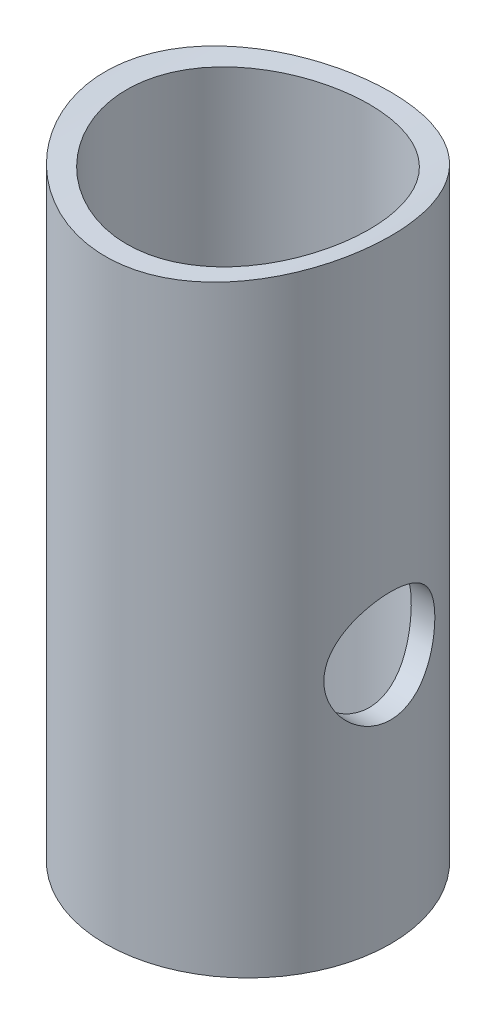
from build123d import *
from OCP.BRepAlgoAPI import BRepAlgoAPI_Cut
from OCP.TopTools import TopTools_ListOfShape

# Parameters (mm, degrees)
SKETCH1_R           = 57.15
SKETCH1_R_2         = 48.59
BOSS_EXTRUDE1_DEPTH = 245.75
CUT_EXTRUDE1_DEPTH  = 57.875
CUT_EXTRUDE2_REACH  = 260.699
SKETCH3_R           = 22.25


with BuildPart() as part:
    # Sketch1 → Boss-Extrude1 (new body)
    with BuildSketch(Plane(origin=(0, 0, 0), x_dir=(1, 0, 0), z_dir=(0, 1, 0))):
        Circle(SKETCH1_R)
        Circle(SKETCH1_R_2, mode=Mode.SUBTRACT)
    extrude(amount=BOSS_EXTRUDE1_DEPTH)


with BuildPart() as cut_extrude1_tool:
    # Sketch2 → Cut-Extrude1 (new, symmetric)
    with BuildSketch(Plane.XY):
        with BuildLine():
            Line((57.15, 245.75), (-57.15, 245.75))
            ThreePointArc((-57.15, 245.75), (0, 238.645023145), (57.15, 245.75))
        make_face()
    extrude(amount=CUT_EXTRUDE1_DEPTH, both=True)


with BuildPart() as part_1:
    add(part.part)

    # Cut-Extrude1: cut by cut_extrude1_tool, with a tolerance
    cut_extrude1_stock = TopTools_ListOfShape()
    cut_extrude1_stock.Append(part_1.part.wrapped)
    cut_extrude1_tools = TopTools_ListOfShape()
    cut_extrude1_tools.Append(cut_extrude1_tool.part.wrapped)
    cut_extrude1_cut = BRepAlgoAPI_Cut()
    cut_extrude1_cut.SetArguments(cut_extrude1_stock)
    cut_extrude1_cut.SetTools(cut_extrude1_tools)
    cut_extrude1_cut.SetFuzzyValue(0.00001)
    cut_extrude1_cut.Build()
    add(Compound.cast(cut_extrude1_cut.Shape()).solids(), mode=Mode.REPLACE)

    # Sketch3 → Cut-Extrude2 (cut, up to next)
    with BuildSketch(Plane(origin=(0, 0, 0), x_dir=(0, 0, -1), z_dir=(1, 0, 0)), mode=Mode.PRIVATE) as cut_extrude2_sk1:
        with Locations((0, 100)):
            Circle(SKETCH3_R)
    cut_extrude2_tool1 = extrude(cut_extrude2_sk1.sketch, amount=CUT_EXTRUDE2_REACH, mode=Mode.PRIVATE) & part_1.part
    add(cut_extrude2_tool1.solids().sort_by_distance((0, 100, 0))[0], mode=Mode.SUBTRACT)


solid = part_1.part
